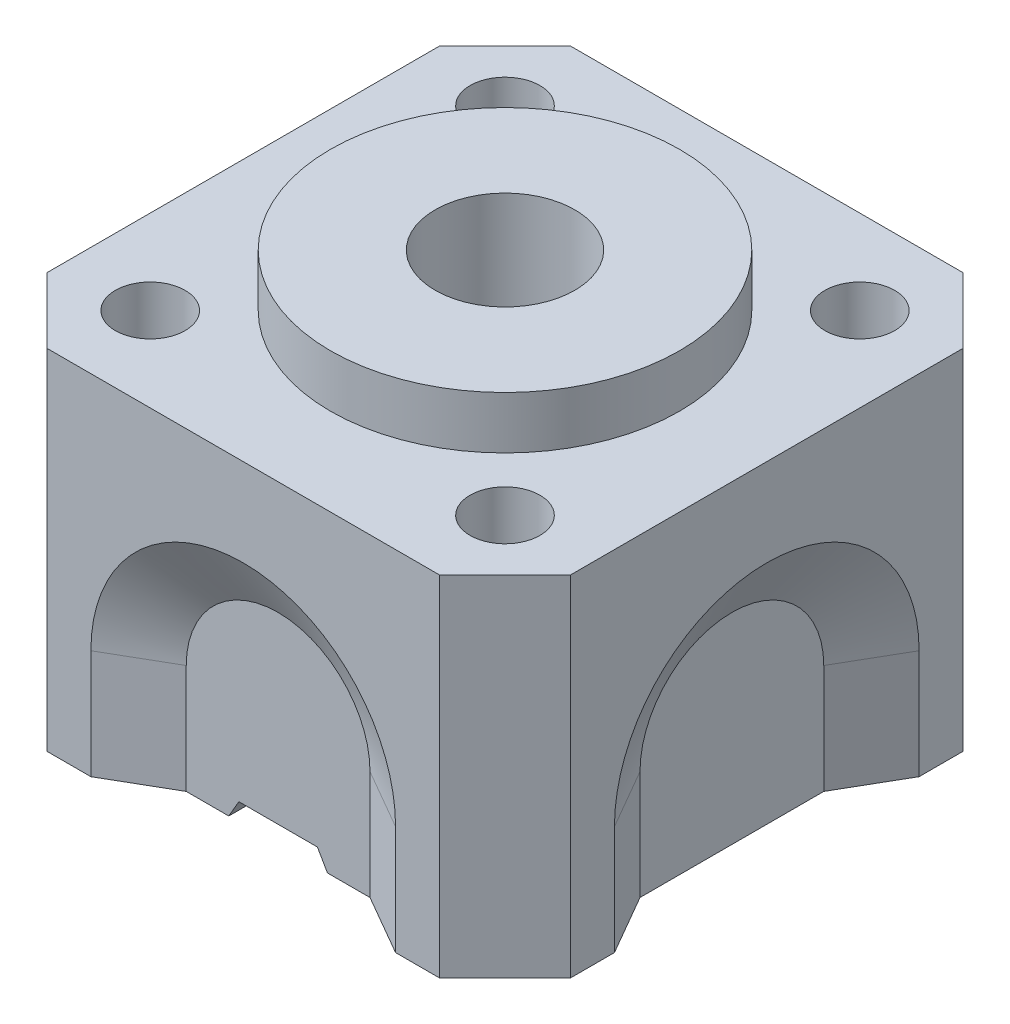
from build123d import *
from OCP.BRepFilletAPI import BRepFilletAPI_MakeChamfer

# Parameters (mm, degrees)
SKETCH1_W                      = 120
SKETCH1_H                      = 120
BOSS_EXTRUDE1_DEPTH            = 80
CHAMFER1_SIZE                  = 15
SKETCH2_R                      = 8
SKETCH2_R_2                    = 16
CUT_EXTRUDE1_DEPTH             = 80
CUT_EXTRUDE2_DEPTH             = 8
CHAMFER3_SIZE                  = 13.856406461
CHAMFER3_SIZE_2                = 8
CIRPATTERN2_COUNT              = 4
CHAMFER3_OF_CIRPATTERN2_SIZE   = 13.856406461
CHAMFER3_OF_CIRPATTERN2_SIZE_2 = 8
BOSS_EXTRUDE2_START            = 12
SKETCH5_R                      = 40
SKETCH5_R_2                    = 16
BOSS_EXTRUDE2_DEPTH            = 12
SKETCH6_R                      = 32.5
CUT_EXTRUDE3_DEPTH             = 25
BOSS_EXTRUDE3_START            = 4
SKETCH17_R                     = 38.5
SKETCH17_R_2                   = 32.5
BOSS_EXTRUDE3_DEPTH            = 4
CUT_EXTRUDE4_DEPTH             = 156


with BuildPart() as part:
    # Sketch1 → Boss-Extrude1 (new body)
    with BuildSketch(Plane(origin=(0, 0, 0), x_dir=(1, 0, 0), z_dir=(0, 1, 0))):
        Rectangle(SKETCH1_W, SKETCH1_H)
    extrude(amount=BOSS_EXTRUDE1_DEPTH)

    # Chamfer1
    chamfer1_edges = [part.edges().sort_by_distance(p)[0] for p in [
        (60, 40, 60),
        (-60, 40, 60),
        (-60, 40, -60),
        (60, 40, -60),
    ]]
    chamfer(chamfer1_edges, length=CHAMFER1_SIZE)

    # Sketch2 → Cut-Extrude1 (cut)
    with BuildSketch(Plane(origin=(0, 80, 0), x_dir=(1, 0, 0), z_dir=(0, 1, 0))):
        with Locations(Location((-40.658639918, 40.658639918, 0), (0, 0, 270))):
            Circle(SKETCH2_R)
        with Locations(Location((40.658639918, 40.658639918, 0), (0, 0, 270))):
            Circle(SKETCH2_R)
        with Locations(Location((40.658639918, -40.658639918, 0), (0, 0, 270))):
            Circle(SKETCH2_R)
        with Locations(Location((-40.658639918, -40.658639918, 0), (0, 0, 270))):
            Circle(SKETCH2_R)
        with Locations(Location((0, 0, 0), (0, 0, 270))):
            Circle(SKETCH2_R_2)
    extrude(amount=-CUT_EXTRUDE1_DEPTH, mode=Mode.SUBTRACT)

    # Sketch3 → Cut-Extrude2 (cut)
    with BuildSketch(Plane(origin=(60, 0, 0), x_dir=(0, 0, -1), z_dir=(1, 0, 0))):
        with BuildLine():
            Line((-21.061459243, 25), (-21.061459243, 0))
            Line((-21.061459243, 0), (0, 0))
            Line((0, 0), (0, 46.061459243))
            ThreePointArc((0, 46.061459243), (-14.892700652, 39.892700652), (-21.061459243, 25))
        make_face()
        with BuildLine():
            Line((0, 46.061459243), (0, 0))
            Line((0, 0), (21.061459243, 0))
            Line((21.061459243, 0), (21.061459243, 25))
            ThreePointArc((21.061459243, 25), (14.892700652, 39.892700652), (0, 46.061459243))
        make_face()
    cut_extrude2 = extrude(amount=-CUT_EXTRUDE2_DEPTH, mode=Mode.SUBTRACT)

    # Chamfer3
    chamfer3_edges_1 = [part.edges().sort_by_distance(p)[0] for p in [
        (60, 12.5, 21.061459243),
    ]]
    chamfer3_side_1 = [part.faces().sort_by_distance(p)[0] for p in [
        (60, 12.5, 21.221459243),
    ]]
    chamfer3_edges_2 = [part.edges().sort_by_distance(p)[0] for p in [
        (60, 46.061459243, 0),
    ]]
    chamfer3_side_2 = [part.faces().sort_by_distance(p)[0] for p in [
        (60, 46.221459243, 0),
    ]]
    chamfer3_edges_3 = [part.edges().sort_by_distance(p)[0] for p in [
        (60, 12.5, -21.061459243),
    ]]
    chamfer3_side_3 = [part.faces().sort_by_distance(p)[0] for p in [
        (60, 12.5, -21.221459243),
    ]]
    chamfer3 = BRepFilletAPI_MakeChamfer(part.part.solid().wrapped)
    for e in chamfer3_edges_1:
        chamfer3.Add(CHAMFER3_SIZE - 0.0001, CHAMFER3_SIZE_2 - 0.0001, e.wrapped, chamfer3_side_1[0].wrapped)
    for e in chamfer3_edges_2:
        chamfer3.Add(CHAMFER3_SIZE - 0.0001, CHAMFER3_SIZE_2 - 0.0001, e.wrapped, chamfer3_side_2[0].wrapped)
    for e in chamfer3_edges_3:
        chamfer3.Add(CHAMFER3_SIZE - 0.0001, CHAMFER3_SIZE_2 - 0.0001, e.wrapped, chamfer3_side_3[0].wrapped)
    add(Compound.cast(chamfer3.Shape()), mode=Mode.REPLACE)  # a hair under: the kernel refuses the full size

    # CirPattern2: Cut-Extrude2 ×4 about axis
    cirpattern2_axis = Axis((0, 0, 0), (0, 1, 0))
    for i in range(1, CIRPATTERN2_COUNT):
        add(cut_extrude2.rotate(cirpattern2_axis, i * 360 / CIRPATTERN2_COUNT), mode=Mode.SUBTRACT)

    # Chamfer3 of CirPattern2
    chamfer3_of_cirpattern2_edges_1 = [part.edges().sort_by_distance(p)[0] for p in [
        (21.061459243, 12.5, -60),
    ]]
    chamfer3_of_cirpattern2_side_1 = [part.faces().sort_by_distance(p)[0] for p in [
        (21.221459243, 12.5, -60),
    ]]
    chamfer3_of_cirpattern2_edges_2 = [part.edges().sort_by_distance(p)[0] for p in [
        (0, 46.061459243, -60),
    ]]
    chamfer3_of_cirpattern2_side_2 = [part.faces().sort_by_distance(p)[0] for p in [
        (0, 46.221459243, -60),
    ]]
    chamfer3_of_cirpattern2_edges_3 = [part.edges().sort_by_distance(p)[0] for p in [
        (-21.061459243, 12.5, -60),
    ]]
    chamfer3_of_cirpattern2_side_3 = [part.faces().sort_by_distance(p)[0] for p in [
        (-21.221459243, 12.5, -60),
    ]]
    chamfer3_of_cirpattern2_edges_4 = [part.edges().sort_by_distance(p)[0] for p in [
        (-60, 12.5, -21.061459243),
    ]]
    chamfer3_of_cirpattern2_side_4 = [part.faces().sort_by_distance(p)[0] for p in [
        (-60, 12.5, -21.221459243),
    ]]
    chamfer3_of_cirpattern2_edges_5 = [part.edges().sort_by_distance(p)[0] for p in [
        (-60, 46.061459243, 0),
    ]]
    chamfer3_of_cirpattern2_side_5 = [part.faces().sort_by_distance(p)[0] for p in [
        (-60, 46.221459243, 0),
    ]]
    chamfer3_of_cirpattern2_edges_6 = [part.edges().sort_by_distance(p)[0] for p in [
        (-60, 12.5, 21.061459243),
    ]]
    chamfer3_of_cirpattern2_side_6 = [part.faces().sort_by_distance(p)[0] for p in [
        (-60, 12.5, 21.221459243),
    ]]
    chamfer3_of_cirpattern2_edges_7 = [part.edges().sort_by_distance(p)[0] for p in [
        (-21.061459243, 12.5, 60),
    ]]
    chamfer3_of_cirpattern2_side_7 = [part.faces().sort_by_distance(p)[0] for p in [
        (-21.221459243, 12.5, 60),
    ]]
    chamfer3_of_cirpattern2_edges_8 = [part.edges().sort_by_distance(p)[0] for p in [
        (0, 46.061459243, 60),
    ]]
    chamfer3_of_cirpattern2_side_8 = [part.faces().sort_by_distance(p)[0] for p in [
        (0, 46.221459243, 60),
    ]]
    chamfer3_of_cirpattern2_edges_9 = [part.edges().sort_by_distance(p)[0] for p in [
        (21.061459243, 12.5, 60),
    ]]
    chamfer3_of_cirpattern2_side_9 = [part.faces().sort_by_distance(p)[0] for p in [
        (21.221459243, 12.5, 60),
    ]]
    chamfer3_of_cirpattern2 = BRepFilletAPI_MakeChamfer(part.part.solid().wrapped)
    for e in chamfer3_of_cirpattern2_edges_1:
        chamfer3_of_cirpattern2.Add(CHAMFER3_OF_CIRPATTERN2_SIZE - 0.0001, CHAMFER3_OF_CIRPATTERN2_SIZE_2 - 0.0001, e.wrapped, chamfer3_of_cirpattern2_side_1[0].wrapped)
    for e in chamfer3_of_cirpattern2_edges_2:
        chamfer3_of_cirpattern2.Add(CHAMFER3_OF_CIRPATTERN2_SIZE - 0.0001, CHAMFER3_OF_CIRPATTERN2_SIZE_2 - 0.0001, e.wrapped, chamfer3_of_cirpattern2_side_2[0].wrapped)
    for e in chamfer3_of_cirpattern2_edges_3:
        chamfer3_of_cirpattern2.Add(CHAMFER3_OF_CIRPATTERN2_SIZE - 0.0001, CHAMFER3_OF_CIRPATTERN2_SIZE_2 - 0.0001, e.wrapped, chamfer3_of_cirpattern2_side_3[0].wrapped)
    for e in chamfer3_of_cirpattern2_edges_4:
        chamfer3_of_cirpattern2.Add(CHAMFER3_OF_CIRPATTERN2_SIZE - 0.0001, CHAMFER3_OF_CIRPATTERN2_SIZE_2 - 0.0001, e.wrapped, chamfer3_of_cirpattern2_side_4[0].wrapped)
    for e in chamfer3_of_cirpattern2_edges_5:
        chamfer3_of_cirpattern2.Add(CHAMFER3_OF_CIRPATTERN2_SIZE - 0.0001, CHAMFER3_OF_CIRPATTERN2_SIZE_2 - 0.0001, e.wrapped, chamfer3_of_cirpattern2_side_5[0].wrapped)
    for e in chamfer3_of_cirpattern2_edges_6:
        chamfer3_of_cirpattern2.Add(CHAMFER3_OF_CIRPATTERN2_SIZE - 0.0001, CHAMFER3_OF_CIRPATTERN2_SIZE_2 - 0.0001, e.wrapped, chamfer3_of_cirpattern2_side_6[0].wrapped)
    for e in chamfer3_of_cirpattern2_edges_7:
        chamfer3_of_cirpattern2.Add(CHAMFER3_OF_CIRPATTERN2_SIZE - 0.0001, CHAMFER3_OF_CIRPATTERN2_SIZE_2 - 0.0001, e.wrapped, chamfer3_of_cirpattern2_side_7[0].wrapped)
    for e in chamfer3_of_cirpattern2_edges_8:
        chamfer3_of_cirpattern2.Add(CHAMFER3_OF_CIRPATTERN2_SIZE - 0.0001, CHAMFER3_OF_CIRPATTERN2_SIZE_2 - 0.0001, e.wrapped, chamfer3_of_cirpattern2_side_8[0].wrapped)
    for e in chamfer3_of_cirpattern2_edges_9:
        chamfer3_of_cirpattern2.Add(CHAMFER3_OF_CIRPATTERN2_SIZE - 0.0001, CHAMFER3_OF_CIRPATTERN2_SIZE_2 - 0.0001, e.wrapped, chamfer3_of_cirpattern2_side_9[0].wrapped)
    add(Compound.cast(chamfer3_of_cirpattern2.Shape()), mode=Mode.REPLACE)  # a hair under: the kernel refuses the full size

    # Sketch5 → Boss-Extrude2 (add)
    with BuildSketch(Plane(origin=(0, 80, 0), x_dir=(1, 0, 0), z_dir=(0, 1, 0)).offset(BOSS_EXTRUDE2_START)):
        with Locations(Location((0, 0, 0), (0, 0, 90))):
            Circle(SKETCH5_R)
        with Locations(Location((0, 0, 0), (0, 0, 270))):
            Circle(SKETCH5_R_2, mode=Mode.SUBTRACT)
    extrude(amount=-BOSS_EXTRUDE2_DEPTH)

    # Sketch6 → Cut-Extrude3 (cut)
    with BuildSketch(Plane.XZ):
        with Locations(Location((0, 0, 0), (0, 0, 270))):
            Circle(SKETCH6_R)
    extrude(amount=-CUT_EXTRUDE3_DEPTH, mode=Mode.SUBTRACT)

    # Sketch17 → Boss-Extrude3 (add)
    with BuildSketch(Plane.XZ.offset(BOSS_EXTRUDE3_START)):
        with Locations(Location((0, 0, 0), (0, 0, 270))):
            Circle(SKETCH17_R)
        with Locations(Location((0, 0, 0), (0, 0, 270))):
            Circle(SKETCH17_R_2, mode=Mode.SUBTRACT)
    extrude(amount=-BOSS_EXTRUDE3_DEPTH)

    # Sketch18 → Cut-Extrude4 (cut)
    with BuildSketch(Plane.XY.offset(52)):
        Polygon((9, 4), (0, 4), (0, 0), (11.309401077, 0), align=None)
        Polygon((0, 4), (-9, 4), (-11.309401077, 0), (0, 0), align=None)
        Polygon((0, 0), (-11.309401077, 0), (-13.618802154, -4), (0, -4), align=None)
        Polygon((11.309401077, 0), (0, 0), (0, -4), (13.618802154, -4), align=None)
    extrude(amount=-CUT_EXTRUDE4_DEPTH, mode=Mode.SUBTRACT)


solid = part.part
